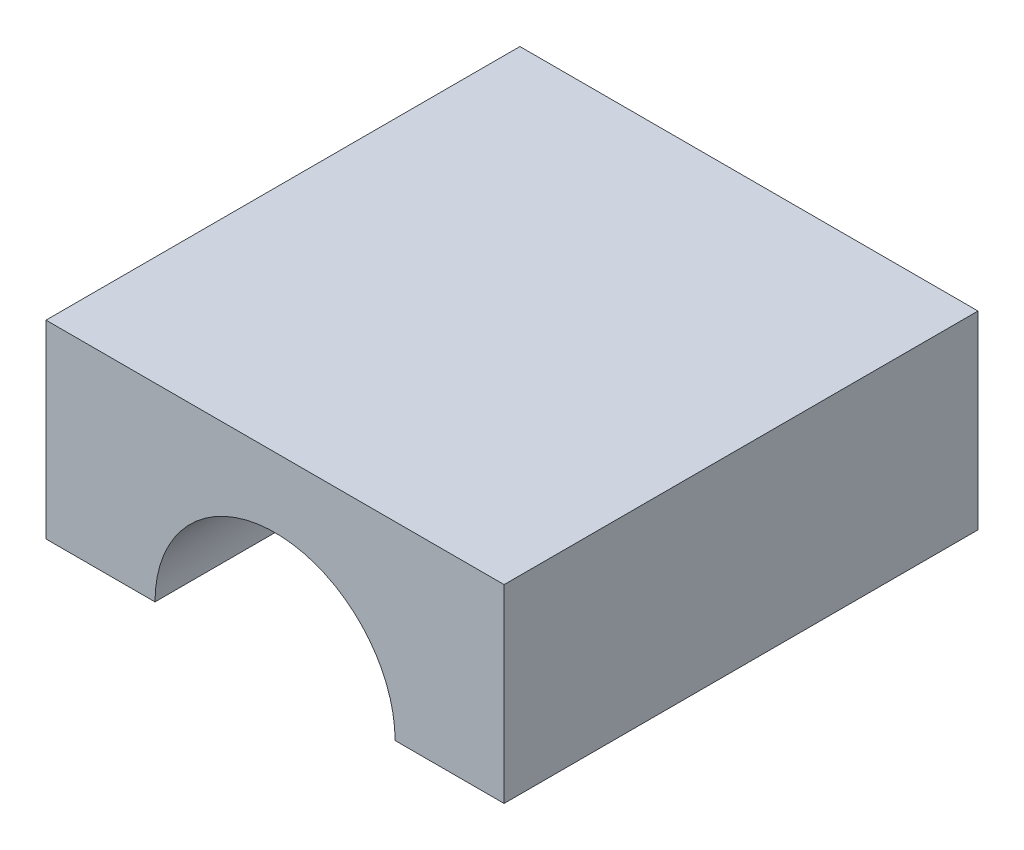
from build123d import *

# Parameters (mm, degrees)
BOSS_EXTRUDE1_DEPTH      = 15
BOSS_EXTRUDE1_DEPTH_BACK = 15


with BuildPart() as part:
    # Sketch1 → Boss-Extrude1 (new, two sides: drawn at the far end of the back side and taken through both)
    with BuildSketch(Plane(origin=(0, 0, 0), x_dir=(0, 1, 0), z_dir=(0, 0, 1)).offset(-BOSS_EXTRUDE1_DEPTH_BACK)):
        with BuildLine():
            Line((12, 0), (0, 0))
            Line((0, 0), (0, -6.9))
            ThreePointArc((0, -6.9), (7.6, -14.5), (0, -22.1))
            Line((0, -22.1), (0, -29))
            Line((0, -29), (12, -29))
            Line((12, -29), (12, 0))
        make_face()
    extrude(amount=BOSS_EXTRUDE1_DEPTH + BOSS_EXTRUDE1_DEPTH_BACK)


solid = part.part
